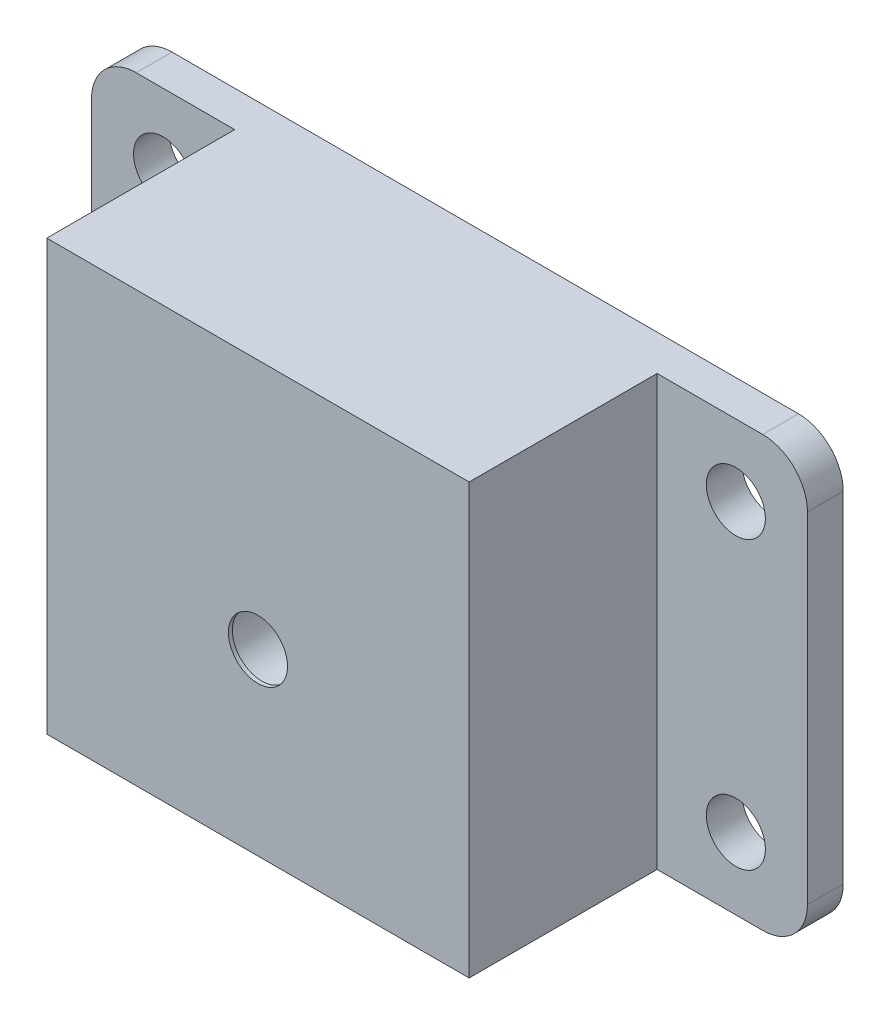
from build123d import *

# Parameters (mm, degrees)
SKETCH1_R           = 1.65
BOSS_EXTRUDE1_DEPTH = 2
BOSS_EXTRUDE2_DEPTH = 5.5
SKETCH3_W           = 23.6
SKETCH3_H           = 24
SKETCH3_R           = 1.65
BOSS_EXTRUDE3_DEPTH = 5
FILLET1_R           = 2.5
SKETCH5_R           = 2
CUT_EXTRUDE1_DEPTH  = 4.78


with BuildPart() as part:
    # Sketch1 → Boss-Extrude1 (new body)
    with BuildSketch(Plane(origin=(0, 0, 0), x_dir=(0, 1, 0), z_dir=(0, 0, 1))):
        Polygon((-24, 12.4), (-4, 12.4), (-4, 28), (-24, 28), (-24, 40), (0, 40), (0, 0), (-24, 0), align=None)
        with Locations((-20, 4)):
            Circle(SKETCH1_R, mode=Mode.SUBTRACT)
        with Locations((-4, 4)):
            Circle(SKETCH1_R, mode=Mode.SUBTRACT)
        with Locations((-4, 36)):
            Circle(SKETCH1_R, mode=Mode.SUBTRACT)
        with Locations((-20, 36)):
            Circle(SKETCH1_R, mode=Mode.SUBTRACT)
    extrude(amount=BOSS_EXTRUDE1_DEPTH)

    # Sketch2 → Boss-Extrude2 (add)
    with BuildSketch(Plane.XY.offset(2)):
        Polygon((-28, -24), (-28, -4), (-12.4, -4), (-12.4, -24), (-8.4, -24), (-8.4, 0), (-32, 0), (-32, -24), align=None)
    extrude(amount=BOSS_EXTRUDE2_DEPTH)

    # Sketch3 → Boss-Extrude3 (add)
    with BuildSketch(Plane.XY.offset(7.5)):
        with Locations((-20.2, -12)):
            Rectangle(SKETCH3_W, SKETCH3_H)
        with Locations((-20.2, -14)):
            Circle(SKETCH3_R, mode=Mode.SUBTRACT)
    extrude(amount=BOSS_EXTRUDE3_DEPTH)

    # Fillet1
    fillet1_edges = [part.edges().sort_by_distance(p)[0] for p in [
        (0, -24, 1),
        (0, 0, 1),
        (-40, 0, 1),
        (-40, -24, 1),
    ]]
    fillet(fillet1_edges, radius=FILLET1_R)

    # Sketch5 → Cut-Extrude1 (cut)
    with BuildSketch(Plane(origin=(0, 0, 7.5), x_dir=(1, 0, 0), z_dir=(0, 0, -1))):
        with Locations((-20.2, 14)):
            Circle(SKETCH5_R)
    extrude(amount=-CUT_EXTRUDE1_DEPTH, mode=Mode.SUBTRACT)


solid = part.part
